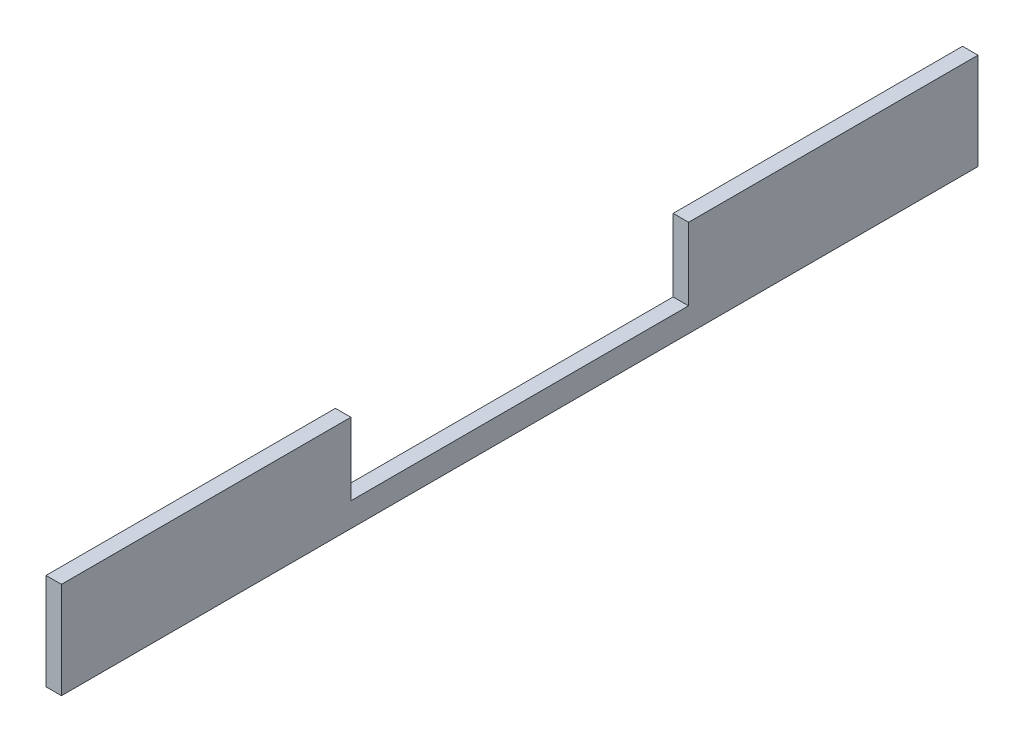
from build123d import *

# Parameters (mm, degrees)
SKETCH1_W           = 190
SKETCH1_H           = 20
BOSS_EXTRUDE1_DEPTH = 3.2
SKETCH2_W           = 70
SKETCH2_H           = 15
CUT_EXTRUDE1_DEPTH  = 10


with BuildPart() as part:
    # Sketch1 → Boss-Extrude1 (new body)
    with BuildSketch(Plane(origin=(0, 0, 0), x_dir=(0, 0, -1), z_dir=(1, 0, 0))):
        with Locations((95, 10)):
            Rectangle(SKETCH1_W, SKETCH1_H)
    extrude(amount=BOSS_EXTRUDE1_DEPTH)

    # Sketch2 → Cut-Extrude1 (cut)
    with BuildSketch(Plane.ZY):
        with Locations((-95, 12.5)):
            Rectangle(SKETCH2_W, SKETCH2_H)
    extrude(amount=-CUT_EXTRUDE1_DEPTH, mode=Mode.SUBTRACT)


solid = part.part
